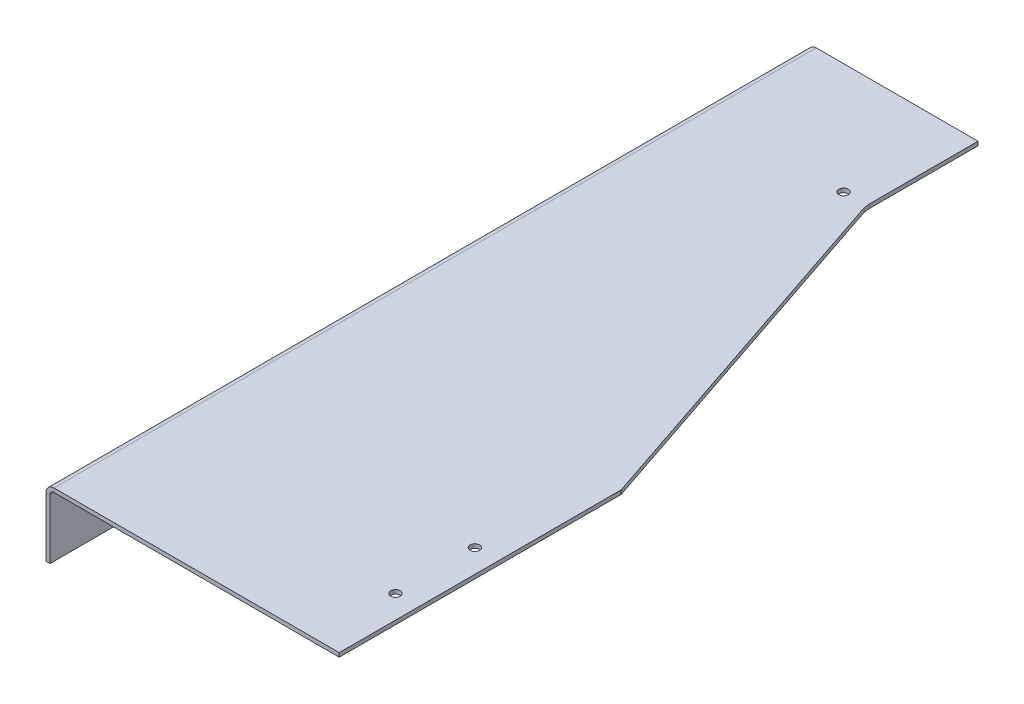
from build123d import *

# Parameters (mm, degrees)
BASE_FLANGE1_DEPTH           = 1.5875
EDGE_FLANGE1_STRIP_W         = 9.5504
EDGE_FLANGE1_STRIP_H         = 1.5875
EDGE_FLANGE1_STRIP_CUT_DEPTH = 304.8
EDGE_FLANGE1_DEPTH           = 304.8
CUT_EXTRUDE1_DEPTH           = 342.722050796
CUT_EXTRUDE1_DEPTH_BACK      = 342.722050796
F_6_CLEARANCE_HOLE1_D        = 3.7973
F_6_CLEARANCE_HOLE2_D        = 3.7973


# Sheet-metal steps are written as plain solids
with BuildPart() as part:
    # Sketch1 → Base-Flange1 (new body)
    with BuildSketch(Plane(origin=(0, 0, 0), x_dir=(1, 0, 0), z_dir=(0, 1, 0))):
        Polygon((0, 304.8), (76.2, 304.8), (152.4, 0), (0, 0), align=None)
    extrude(amount=-BASE_FLANGE1_DEPTH)

    # Edge-Flange1 strip (across the edge) → Edge-Flange1 strip cut (cut)
    with BuildSketch(Plane(origin=(0, -1.5875, 0), x_dir=(1, 0, 0), z_dir=(0, 0, -1))):
        with Locations((-1.5875, -0.79375)):
            Rectangle(EDGE_FLANGE1_STRIP_W, EDGE_FLANGE1_STRIP_H)
    extrude(amount=EDGE_FLANGE1_STRIP_CUT_DEPTH, mode=Mode.SUBTRACT)

    # Edge-Flange1 section (across the edge) → Edge-Flange1 (add)
    with BuildSketch(Plane(origin=(0, -1.5875, 0), x_dir=(1, 0, 0), z_dir=(0, 0, -1))):
        with BuildLine():
            Line((0, 1.6002), (0, 25.4))
            Line((0, 25.4), (1.5875, 25.4))
            Line((1.5875, 25.4), (1.5875, 1.6002))
            ThreePointArc((1.5875, 1.6002), (2.056187729, 0.468687729), (3.1877, 0))
            Line((3.1877, 0), (3.1877, -1.5875))
            ThreePointArc((3.1877, -1.5875), (0.933655714, -0.653844286), (0, 1.6002))
        make_face()
    extrude(amount=EDGE_FLANGE1_DEPTH)

    # Sketch9 → Cut-Extrude1 (cut, two sides: drawn at the far end of the back side and taken through both)
    with BuildSketch(Plane(origin=(0, -1.5875, 0), x_dir=(-1, 0, 0), z_dir=(0, -1, 0)).offset(-CUT_EXTRUDE1_DEPTH_BACK)):
        Polygon((-67.85590566, 967.941443334), (-67.85590566, 304.8), (-67.85590566, 261.227267277), (-68.183918061, 258.867768839), (-116.937952517, 113.626422367), (-117.240761897, 112.724334108), (-117.240761897, 0), (-117.240761897, -663.141443334), (-1442.916152839, -623.003514641), (-1393.531296603, 1008.079372028), align=None)
    extrude(amount=CUT_EXTRUDE1_DEPTH + CUT_EXTRUDE1_DEPTH_BACK, mode=Mode.SUBTRACT)

    # #6 Clearance Hole1 (through all)
    with Locations(Plane(origin=(0, 0, 0), x_dir=(1, 0, 0), z_dir=(0, 1, 0))):
        with Locations((58.564398425, 260.349999742)):
            Hole(F_6_CLEARANCE_HOLE1_D / 2)

    # #6 Clearance Hole2 (through all)
    with Locations(Plane(origin=(0, 0, 0), x_dir=(1, 0, 0), z_dir=(0, 1, 0))):
        with Locations((107.989583034, 31.750001764), (107.989583034, 63.500001764)):
            Hole(F_6_CLEARANCE_HOLE2_D / 2)


solid = part.part
